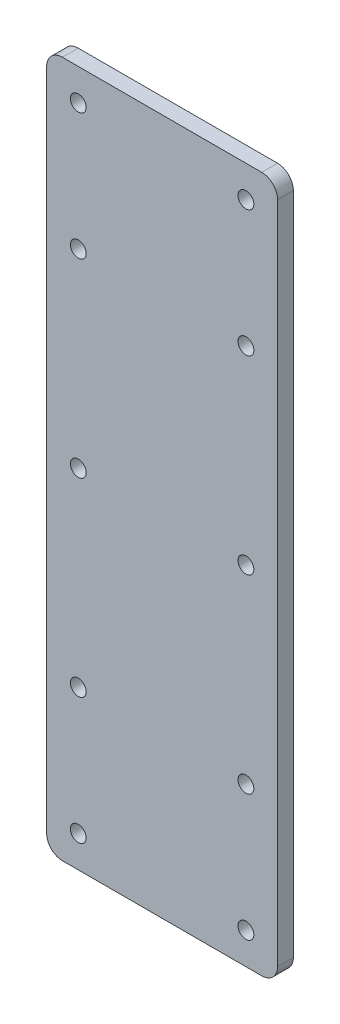
from build123d import *

# Parameters (mm, degrees)
SKETCH2_R           = 2.5
BOSS_EXTRUDE1_DEPTH = 5


with BuildPart() as part:
    # Sketch2 → Boss-Extrude1 (new body)
    with BuildSketch(Plane.XY):
        with BuildLine():
            ThreePointArc((0, 5), (1.464466094, 1.464466094), (5, 0))
            Line((5, 0), (68, 0))
            ThreePointArc((68, 0), (71.535533906, 1.464466094), (73, 5))
            Line((73, 5), (73, 215))
            ThreePointArc((73, 215), (71.535533906, 218.535533906), (68, 220))
            Line((68, 220), (5, 220))
            ThreePointArc((5, 220), (1.464466094, 218.535533906), (0, 215))
            Line((0, 215), (0, 5))
        make_face()
        with Locations((10, 50)):
            Circle(SKETCH2_R, mode=Mode.SUBTRACT)
        with Locations((10, 10)):
            Circle(SKETCH2_R, mode=Mode.SUBTRACT)
        with Locations((63, 10)):
            Circle(SKETCH2_R, mode=Mode.SUBTRACT)
        with Locations((63, 50)):
            Circle(SKETCH2_R, mode=Mode.SUBTRACT)
        with Locations((10, 110)):
            Circle(SKETCH2_R, mode=Mode.SUBTRACT)
        with Locations((63, 110)):
            Circle(SKETCH2_R, mode=Mode.SUBTRACT)
        with Locations((10, 210)):
            Circle(SKETCH2_R, mode=Mode.SUBTRACT)
        with Locations((10, 170)):
            Circle(SKETCH2_R, mode=Mode.SUBTRACT)
        with Locations((63, 170)):
            Circle(SKETCH2_R, mode=Mode.SUBTRACT)
        with Locations((63, 210)):
            Circle(SKETCH2_R, mode=Mode.SUBTRACT)
    extrude(amount=BOSS_EXTRUDE1_DEPTH)


solid = part.part
